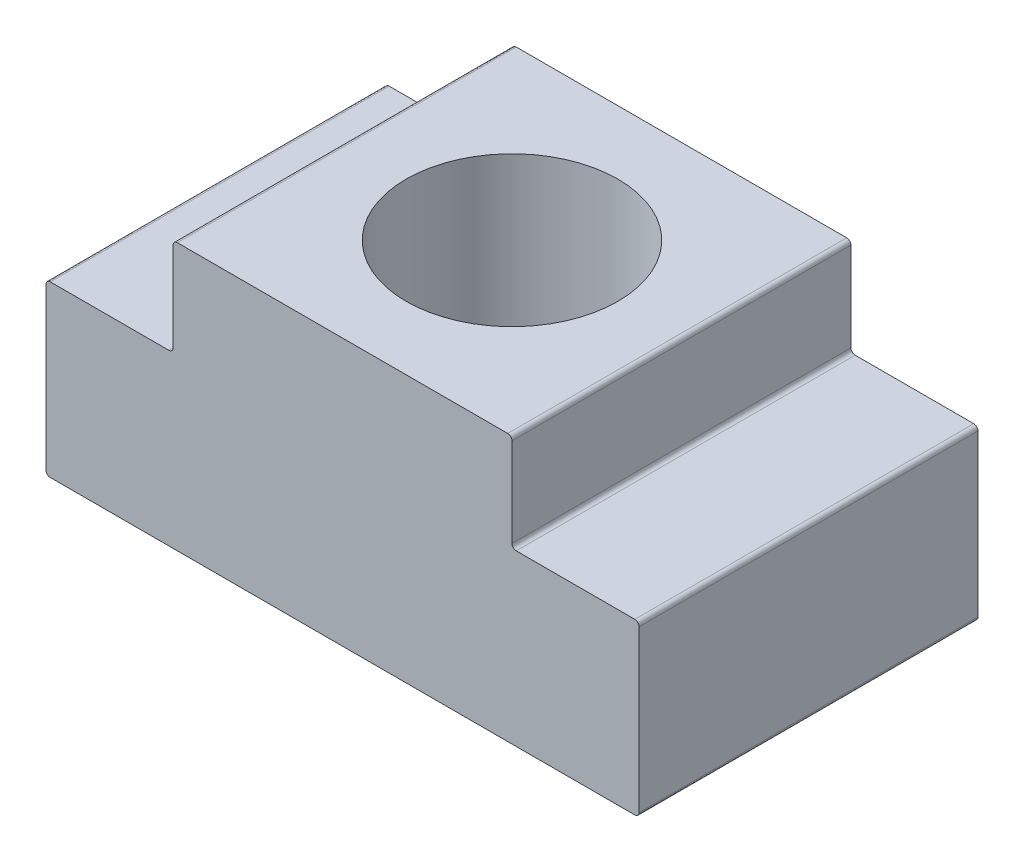
from build123d import *

# Parameters (mm, degrees)
BOSS_EXTRUDE1_DEPTH = 8
SKETCH2_R           = 2.5
CUT_EXTRUDE1_DEPTH  = 7
FILLET1_R           = 0.1


with BuildPart() as part:
    # Sketch1 → Boss-Extrude1 (new body)
    with BuildSketch(Plane.XY):
        Polygon((0, 6.3), (4, 6.3), (4, 4), (7, 4), (7, 0), (0, 0), align=None)
    boss_extrude1 = extrude(amount=BOSS_EXTRUDE1_DEPTH)

    # Mirror1: Boss-Extrude1 across plane
    add(boss_extrude1.mirror(Plane(origin=(0, 0, 0), x_dir=(0, 0, 1), z_dir=(1, 0, 0))))

    # Sketch2 → Cut-Extrude1 (cut)
    with BuildSketch(Plane(origin=(0, 6.3, 0), x_dir=(1, 0, 0), z_dir=(0, 1, 0))):
        with Locations((0, -4)):
            Circle(SKETCH2_R)
    extrude(amount=-CUT_EXTRUDE1_DEPTH, mode=Mode.SUBTRACT)

    # Fillet1
    fillet1_edges = [part.edges().sort_by_distance(p)[0] for p in [
        (4, 4, 4),
        (7, 0, 4),
        (7, 4, 4),
        (-4, 6.3, 4),
        (4, 6.3, 4),
        (-7, 0, 4),
        (-7, 4, 4),
        (-4, 4, 4),
    ]]
    fillet(fillet1_edges, radius=FILLET1_R)


solid = part.part
